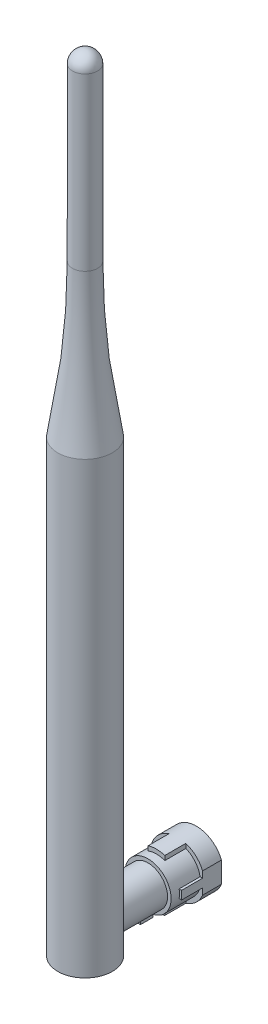
from build123d import *

# Parameters (mm, degrees)
BOSS_EXTRUDE1_DEPTH      = 4.5
BOSS_EXTRUDE2_DEPTH      = 5
SKETCH3_R                = 5.5
BOSS_EXTRUDE3_DEPTH      = 2
BOSS_EXTRUDE4_DEPTH      = 3
SKETCH5_R                = 4.65
BOSS_EXTRUDE5_DEPTH      = 12
BOSS_EXTRUDE6_DEPTH      = 100
BOSS_EXTRUDE6_DEPTH_BACK = 7
SKETCH6_R                = 6.5
SKETCH7_R                = 3
BOSS_EXTRUDE7_DEPTH      = 80
FILLET1_R                = 190
FILLET2_R                = 3


with BuildPart() as part:
    # Sketch1 → Boss-Extrude1 (new body)
    with BuildSketch(Plane.XY):
        with BuildLine():
            Line((-6, 2.5), (-6, -2.5))
            ThreePointArc((-6, -2.5), (0, -6.5), (6, -2.5))
            Line((6, -2.5), (6, 2.5))
            ThreePointArc((6, 2.5), (0, 6.5), (-6, 2.5))
        make_face()
    extrude(amount=BOSS_EXTRUDE1_DEPTH)

    # Sketch2 → Boss-Extrude2 (add)
    with BuildSketch(Plane.XY.offset(4.5)):
        with BuildLine():
            ThreePointArc((2, 6.184658438), (0, 6.5), (-2, 6.184658438))
            Line((-2, 6.184658438), (-2, 5.123475383))
            ThreePointArc((-2, 5.123475383), (-4.239291123, 3.504056332), (-5.408326913, 1))
            Line((-5.408326913, 1), (-6, 1))
            Line((-6, 1), (-6, -1))
            Line((-6, -1), (-5.408326913, -1))
            ThreePointArc((-5.408326913, -1), (-4.239291123, -3.504056332), (-2, -5.123475383))
            Line((-2, -5.123475383), (-2, -6.184658438))
            ThreePointArc((-2, -6.184658438), (0, -6.5), (2, -6.184658438))
            Line((2, -6.184658438), (2, -5.123475383))
            ThreePointArc((2, -5.123475383), (4.239291123, -3.504056332), (5.408326913, -1))
            Line((5.408326913, -1), (6, -1))
            Line((6, -1), (6, 1))
            Line((6, 1), (5.408326913, 1))
            ThreePointArc((5.408326913, 1), (4.239291123, 3.504056332), (2, 5.123475383))
            Line((2, 5.123475383), (2, 6.184658438))
        make_face()
    extrude(amount=BOSS_EXTRUDE2_DEPTH)

    # Sketch3 → Boss-Extrude3 (add)
    with BuildSketch(Plane.XY.offset(9.5)):
        with Locations(Location((0, 0, 0), (0, 0, 169.524318304))):
            Circle(SKETCH3_R)
    extrude(amount=BOSS_EXTRUDE3_DEPTH)

    # Sketch4 → Boss-Extrude4 (add)
    with BuildSketch(Plane.XY.offset(11.5)):
        with BuildLine():
            Line((-1.2, -4.49249374), (-1.2, -5.99249374))
            Line((-1.2, -5.99249374), (1.2, -5.99249374))
            Line((1.2, -5.99249374), (1.2, -4.49249374))
            ThreePointArc((1.2, -4.49249374), (0, 4.65), (-1.2, -4.49249374))
        make_face()
    extrude(amount=BOSS_EXTRUDE4_DEPTH)

    # Sketch5 → Boss-Extrude5 (add)
    with BuildSketch(Plane.XY.offset(14.5)):
        with Locations(Location((0, 0, 0), (0, 0, 255.044751683))):
            Circle(SKETCH5_R)
    extrude(amount=BOSS_EXTRUDE5_DEPTH)

    # Sketch6 → Boss-Extrude6 (add, two sides: drawn at the far end of the back side and taken through both)
    with BuildSketch(Plane(origin=(0, 0, 0), x_dir=(1, 0, 0), z_dir=(0, 1, 0)).offset(-BOSS_EXTRUDE6_DEPTH_BACK)):
        with Locations(Location((0, -26.5, 0), (0, 0, 270))):
            Circle(SKETCH6_R)
    extrude(amount=BOSS_EXTRUDE6_DEPTH + BOSS_EXTRUDE6_DEPTH_BACK)

    # Sketch7 → Boss-Extrude7 (add)
    with BuildSketch(Plane(origin=(0, 100, 0), x_dir=(1, 0, 0), z_dir=(0, 1, 0))):
        with Locations(Location((0, -26.5, 0), (0, 0, 270))):
            Circle(SKETCH7_R)
    extrude(amount=BOSS_EXTRUDE7_DEPTH)

    # Fillet1
    # the kernel refuses this fillet: 190 mm, written as the material it adds along each edge
    with BuildSketch(Plane(origin=(0, 100, 26.5), x_dir=(0, 0, 1), z_dir=(-1, 0, 0))) as fillet1_piece_1:
        with BuildLine():
            CenterArc((193, 36.300826437), FILLET1_R, 180, 11.014474836)
            Line((3, 36.300826437), (0, 36.300826437))
            Line((0, 36.300826437), (0, 0))
            Line((0, 0), (3, -3.8))
            ThreePointArc((3, -3.8), (4.75, -3.8), (2.77, -0.726016529))
            Line((2.77, -0.726016529), (6.5, 0))
        make_face()
    revolve(axis=Axis((0, 100, 26.5), (0, 1, 0)))

    # Fillet2
    fillet2_edges = [part.edges().sort_by_distance(p)[0] for p in [
        (0, 180, 23.5),
    ]]
    fillet(fillet2_edges, radius=FILLET2_R)


solid = part.part
